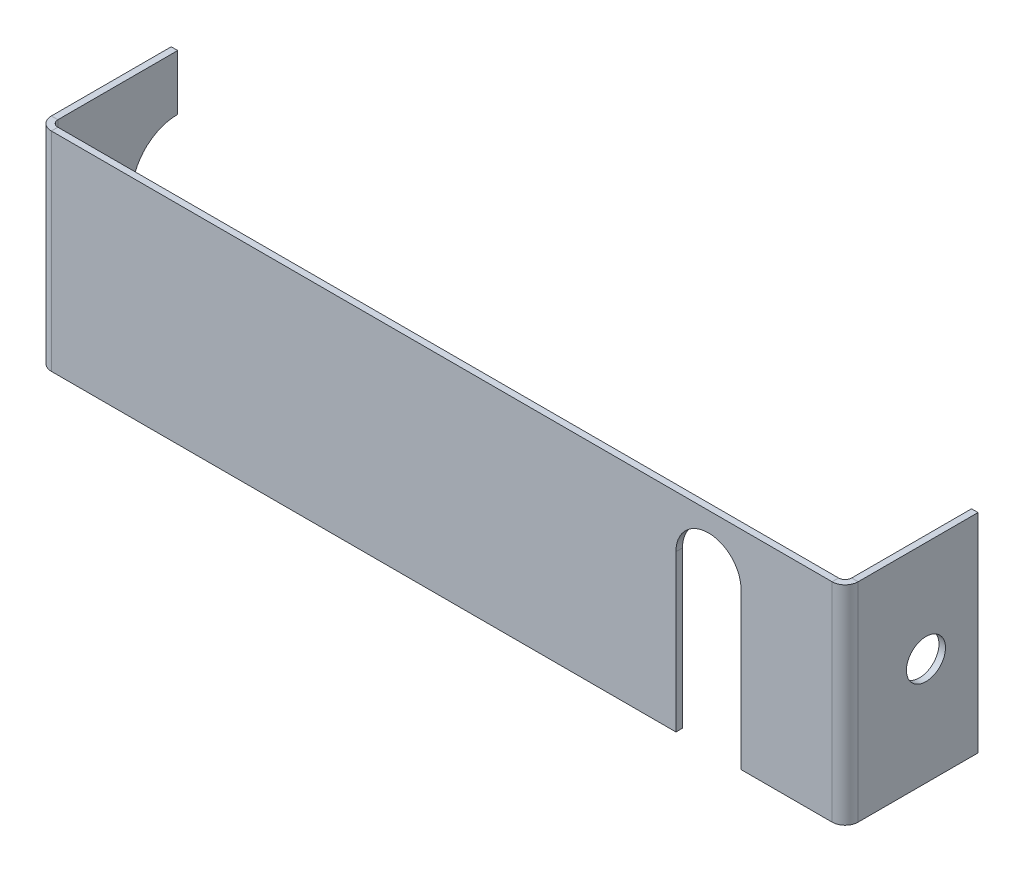
from build123d import *

# Parameters (mm, degrees)
BRIDA_BASE1_DEPTH      = 16
CROQUIS6_R             = 1.5
CROQUIS6_W             = 9.788625446
CROQUIS6_H             = 16
CORTAR_EXTRUIR8_DEPTH  = 0.5
CROQUIS10_R            = 1.5
CORTAR_EXTRUIR10_DEPTH = 0.5
CORTAR_EXTRUIR11_DEPTH = 0.5


# Sheet-metal steps are written as plain solids
with BuildPart() as part:
    # Croquis1 → Brida base1 (new body)
    with BuildSketch(Plane(origin=(0, 0, 0), x_dir=(1, 0, 0), z_dir=(0, 1, 0))):
        with BuildLine():
            Line((-58.939086294, 3.693519459), (-58.939086294, -15.306480541))
            ThreePointArc((-58.939086294, -15.306480541), (-58.646193076, -16.013587323), (-57.939086294, -16.306480541))
            Line((-57.939086294, -16.306480541), (2.060913706, -16.306480541))
            ThreePointArc((2.060913706, -16.306480541), (2.768020487, -16.013587323), (3.060913706, -15.306480541))
            Line((3.060913706, -15.306480541), (3.060913706, 3.693519459))
            Line((3.060913706, 3.693519459), (2.560913706, 3.693519459))
            Line((2.560913706, 3.693519459), (2.560913706, -15.306480541))
            ThreePointArc((2.560913706, -15.306480541), (2.414467096, -15.660033932), (2.060913706, -15.806480541))
            Line((2.060913706, -15.806480541), (-57.939086294, -15.806480541))
            ThreePointArc((-57.939086294, -15.806480541), (-58.292639685, -15.660033932), (-58.439086294, -15.306480541))
            Line((-58.439086294, -15.306480541), (-58.439086294, 3.693519459))
            Line((-58.439086294, 3.693519459), (-58.939086294, 3.693519459))
        make_face()
    extrude(amount=BRIDA_BASE1_DEPTH)

    # Croquis6 → Cortar-Extruir8 (cut)
    with BuildSketch(Plane(origin=(3.060913706, 0, 0), x_dir=(0, 0, -1), z_dir=(1, 0, 0))):
        with Locations((-10.095105987, 8.25)):
            Circle(CROQUIS6_R)
        with Locations((-1.200793264, 8)):
            Rectangle(CROQUIS6_W, CROQUIS6_H)
    extrude(amount=-CORTAR_EXTRUIR8_DEPTH, mode=Mode.SUBTRACT)

    # Croquis10 → Cortar-Extruir10 (cut)
    with BuildSketch(Plane.ZY.offset(58.939086294)):
        with BuildLine():
            Line((6.112352523, 11.75), (6.095105987, 16))
            Line((6.095105987, 16), (-3.693519459, 16))
            Line((-3.693519459, 16), (-3.693519459, 0))
            Line((-3.693519459, 0), (6.095105987, 0))
            Line((6.095105987, 0), (9.612352523, 0))
            Line((9.612352523, 0), (9.612352523, 8.25))
            ThreePointArc((9.612352523, 8.25), (8.587226257, 10.724873734), (6.112352523, 11.75))
        make_face()
        with Locations((11.572352523, 8.25)):
            Circle(CROQUIS10_R)
    extrude(amount=-CORTAR_EXTRUIR10_DEPTH, mode=Mode.SUBTRACT)

    # Croquis11 → Cortar-Extruir11 (cut)
    with BuildSketch(Plane.XY.offset(16.306480541)):
        with BuildLine():
            Line((-9.939086294, 12), (-9.939086294, 0))
            Line((-9.939086294, 0), (-4.939086294, 0))
            Line((-4.939086294, 0), (-4.939086294, 12))
            ThreePointArc((-4.939086294, 12), (-7.439086294, 14.5), (-9.939086294, 12))
        make_face()
    extrude(amount=-CORTAR_EXTRUIR11_DEPTH, mode=Mode.SUBTRACT)


solid = part.part
